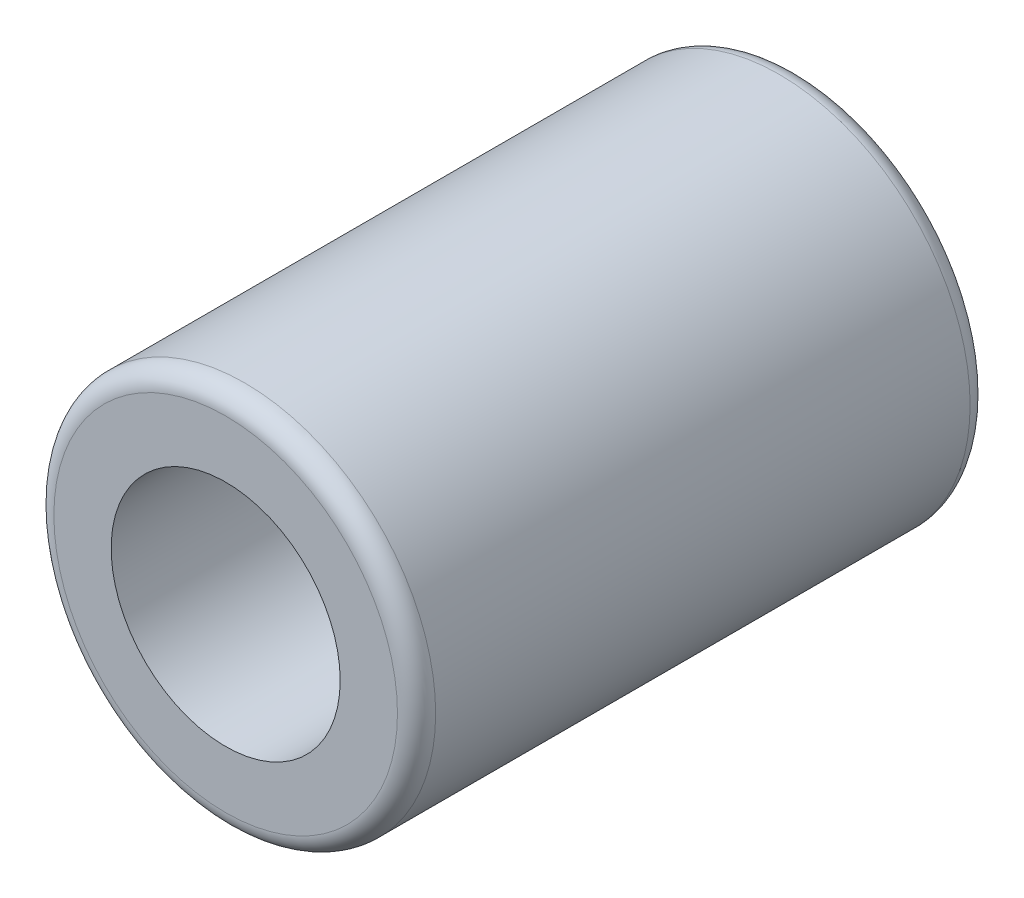
from build123d import *

# Parameters (mm, degrees)
SKETCH2_R           = 5
SKETCH2_R_2         = 2.5
BOSS_EXTRUDE1_DEPTH = 15
SKETCH3_R           = 3
CUT_EXTRUDE1_DEPTH  = 10
SKETCH4_R           = 1.5
CUT_EXTRUDE2_DEPTH  = 17.583123952
FILLET1_R           = 0.5


with BuildPart() as part:
    # Sketch2 → Boss-Extrude1 (new body)
    with BuildSketch(Plane.XY):
        Circle(SKETCH2_R)
        Circle(SKETCH2_R_2, mode=Mode.SUBTRACT)
    extrude(amount=BOSS_EXTRUDE1_DEPTH)

    # Sketch3 → Cut-Extrude1 (cut)
    with BuildSketch(Plane.XY.offset(15)):
        Circle(SKETCH3_R)
    extrude(amount=-CUT_EXTRUDE1_DEPTH, mode=Mode.SUBTRACT)

    # Sketch4 → Cut-Extrude2 (cut, through all)
    with BuildSketch(Plane(origin=(0, 0, 0), x_dir=(1, 0, 0), z_dir=(0, 1, 0))):
        with Locations((0, -3.052449039)):
            Circle(SKETCH4_R)
        with Locations((0, -9.880122012)):
            Circle(SKETCH4_R)
    extrude(amount=-CUT_EXTRUDE2_DEPTH, mode=Mode.SUBTRACT)

    # Fillet1
    fillet1_edges = [part.edges().sort_by_distance(p)[0] for p in [
        (-5, 0, 15),
        (-5, 0, 0),
    ]]
    fillet(fillet1_edges, radius=FILLET1_R)


solid = part.part
